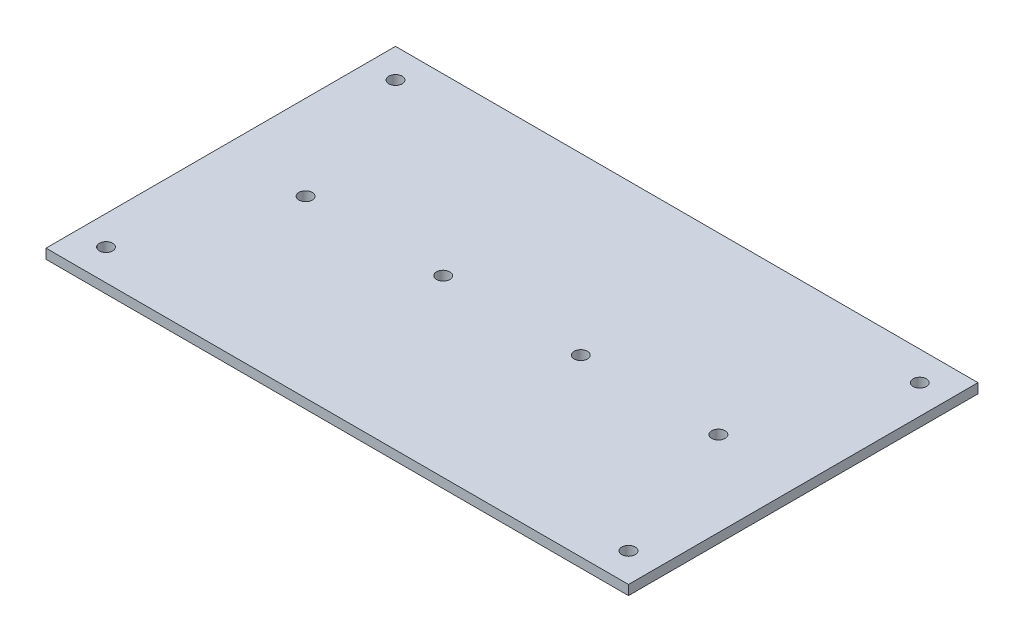
from build123d import *

# Parameters (mm, degrees)
SKETCH1_W                             = 381
SKETCH1_H                             = 228.6
BASE_DEPTH                            = 6.35
HOLE_FOR_1_4_BLIND_FASTENERS_B_BS_1_D = 8.7376
HOLE_FOR_1_4_BLIND_FASTENERS_B_BS_2_D = 8.7376


with BuildPart() as part:
    # Sketch1 → Base (new body)
    with BuildSketch(Plane(origin=(0, 0, 0), x_dir=(1, 0, 0), z_dir=(0, 1, 0))):
        with Locations((190.5, -114.3)):
            Rectangle(SKETCH1_W, SKETCH1_H)
    extrude(amount=-BASE_DEPTH)

    # Hole for 1/4 Blind Fasteners (B,BS)1 (through all)
    with Locations(Plane(origin=(0, 0, 0), x_dir=(1, 0, 0), z_dir=(0, 1, 0))):
        with Locations((55.5, -114.3), (145.49982, -114.3), (235.49964, -114.3), (325.49946, -114.3)):
            Hole(HOLE_FOR_1_4_BLIND_FASTENERS_B_BS_1_D / 2)

    # Hole for 1/4 Blind Fasteners (B,BS)2 (through all)
    with Locations(Plane(origin=(0, 0, 0), x_dir=(1, 0, 0), z_dir=(0, 1, 0))):
        with Locations((19.05, -19.05), (19.03407818, -208.365498456), (361.95, -19.05), (361.95, -209.55)):
            Hole(HOLE_FOR_1_4_BLIND_FASTENERS_B_BS_2_D / 2)


solid = part.part
